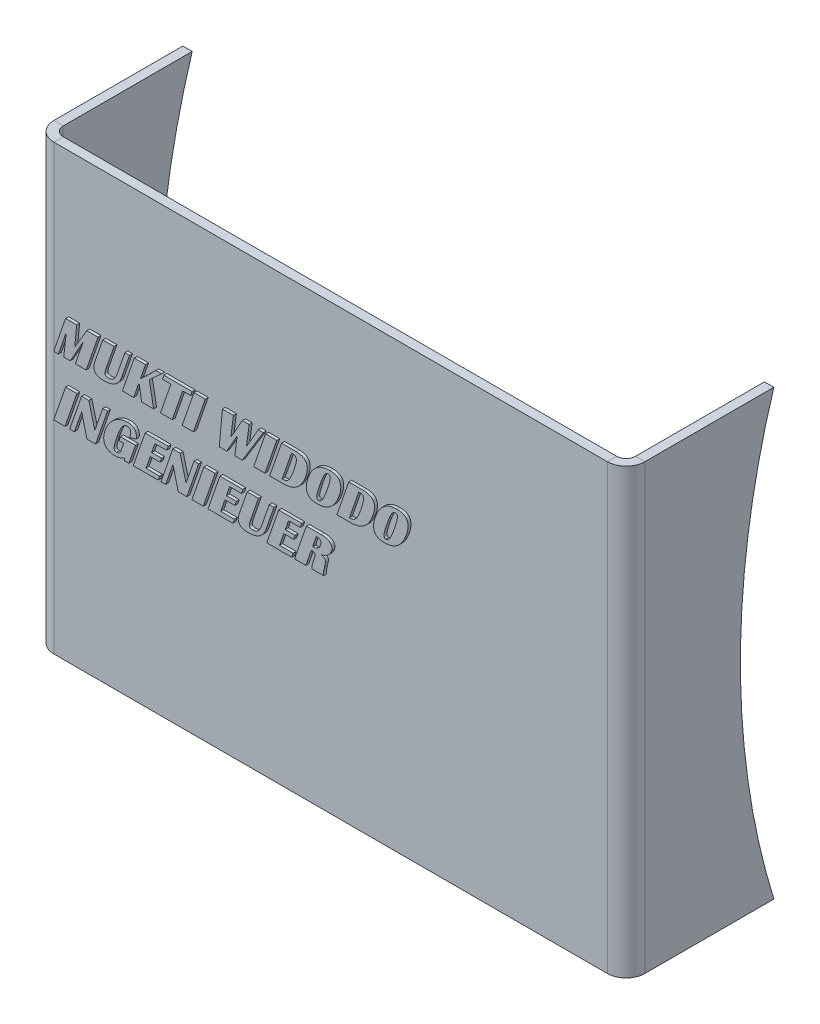
from build123d import *

# Parameters (mm, degrees)
BASE_FLANGE1_DEPTH             = 75
CUT_EXTRUDE1_REACH             = 136.629
CUT_EXTRUDE1_DIRECTION_2_REACH = 136.629
BOSS_EXTRUDE1_DEPTH            = 1


# Sheet-metal steps are written as plain solids
with BuildPart() as part:
    # Sketch1 → Base-Flange1 (new, symmetric)
    with BuildSketch(Plane(origin=(0, 0, 0), x_dir=(1, 0, 0), z_dir=(0, 1, 0))):
        with BuildLine():
            Line((-100, 50), (-100, 6.35))
            ThreePointArc((-100, 6.35), (-98.140128061, 1.859871939), (-93.65, 0))
            Line((-93.65, 0), (93.65, 0))
            ThreePointArc((93.65, 0), (98.140128061, 1.859871939), (100, 6.35))
            Line((100, 6.35), (100, 50))
            Line((100, 50), (96.825, 50))
            Line((96.825, 50), (96.825, 6.35))
            ThreePointArc((96.825, 6.35), (95.89506403, 4.10493597), (93.65, 3.175))
            Line((93.65, 3.175), (-93.65, 3.175))
            ThreePointArc((-93.65, 3.175), (-95.89506403, 4.10493597), (-96.825, 6.35))
            Line((-96.825, 6.35), (-96.825, 50))
            Line((-96.825, 50), (-100, 50))
        make_face()
    extrude(amount=BASE_FLANGE1_DEPTH, both=True)

    # Sketch6 → Cut-Extrude1 (cut, up to next)
    with BuildSketch(Plane(origin=(0, 0, 0), x_dir=(0, 0, -1), z_dir=(1, 0, 0)), mode=Mode.PRIVATE) as cut_extrude1_sk1:
        with BuildLine():
            Line((50, 75), (50, -75))
            ThreePointArc((50, -75), (38.674679355, 0), (50, 75))
        make_face()
    cut_extrude1_tool1 = extrude(cut_extrude1_sk1.sketch, amount=-CUT_EXTRUDE1_REACH, mode=Mode.PRIVATE) & part.part
    add(cut_extrude1_tool1.solids().sort_by_distance((0, 0, -45.461102))[0], mode=Mode.SUBTRACT)

    # Sketch6 → Cut-Extrude1 direction 2 (cut, up to next)
    with BuildSketch(Plane(origin=(0, 0, 0), x_dir=(0, 0, -1), z_dir=(1, 0, 0)), mode=Mode.PRIVATE) as cut_extrude1_direction_2_sk1:
        with BuildLine():
            Line((50, 75), (50, -75))
            ThreePointArc((50, -75), (38.674679355, 0), (50, 75))
        make_face()
    cut_extrude1_direction_2_tool1 = extrude(cut_extrude1_direction_2_sk1.sketch, amount=CUT_EXTRUDE1_DIRECTION_2_REACH, mode=Mode.PRIVATE) & part.part
    add(cut_extrude1_direction_2_tool1.solids().sort_by_distance((0, 0, -45.461102))[0], mode=Mode.SUBTRACT)

    # Sketch7 → Boss-Extrude1 (add)
    # profile 1 of 21: a face of its own
    with BuildSketch(Plane.XY):
        Polygon((-77.688894145, 26.320100911), (-81.712744141, 14.701171875), (-85.373502604, 14.701171875), (-82.672698466, 22.502665965), (-87.116839345, 14.701171875), (-89.312797038, 14.701171875), (-88.447345988, 22.370858765), (-91.103385417, 14.701171875), (-92.695019531, 14.701171875), (-88.671169535, 26.320100911), (-84.930829366, 26.320100911), (-85.589865367, 19.461152649), (-81.50881602, 26.320100911), align=None)
    # profile 2 of 21: a face of its own
    with BuildSketch(Plane.XY):
        with BuildLine():
            Line((-67.024945577, 26.320100911), (-69.71828893, 18.545963033))
            add(Edge.make_bspline(
                [(-69.71828893, 18.545963033), (-69.778067687, 18.38333502), (-69.895320407, 18.064349182), (-70.109063514, 17.61042146), (-70.344185944, 17.186278563), (-70.606943629, 16.794270156), (-70.892499446, 16.431245885), (-71.208099755, 16.102578106), (-71.545473536, 15.803144405), (-71.910904307, 15.537084212), (-72.300264523, 15.301607464), (-72.715310699, 15.096692569), (-73.155377358, 14.924342046), (-73.621730573, 14.786313586), (-74.112875917, 14.677028586), (-74.628692299, 14.597737239), (-75.169541154, 14.549613462), (-75.538429297, 14.544578354), (-75.726707713, 14.542008464)],
                knots=[0, 0, 0, 0, 1.06762481, 2.094086916, 3.089238705, 4.054405645, 5.000113119, 5.932612711, 6.859438436, 7.777275193, 8.714996723, 9.661118284, 10.627137087, 11.62464768, 12.656134527, 13.726483014, 14.839609821, 16, 16, 16, 16], degree=3))
            add(Edge.make_bspline(
                [(-75.726707713, 14.542008464), (-75.904211339, 14.544505222), (-76.245811575, 14.549310157), (-76.734907109, 14.595750898), (-77.17906163, 14.675200529), (-77.577930684, 14.782611043), (-77.932932887, 14.921353185), (-78.242468286, 15.092532326), (-78.505882903, 15.298741442), (-78.721613631, 15.537603292), (-78.895272076, 15.806293596), (-79.019678886, 16.108019152), (-79.095731109, 16.441529927), (-79.127629336, 16.804637186), (-79.108554251, 17.198096687), (-79.052258231, 17.622440031), (-78.94156347, 18.07629722), (-78.842361956, 18.384932177), (-78.790603383, 18.545963033)],
                knots=[0, 0, 0, 0, 1.333887678, 2.567025566, 3.687732696, 4.721648759, 5.666926028, 6.545649541, 7.37083136, 8.169257334, 8.953926247, 9.763913545, 10.608738382, 11.515809463, 12.494738975, 13.563603365, 14.728805576, 16, 16, 16, 16], degree=3))
            Line((-78.790603383, 18.545963033), (-76.09726003, 26.320100911))
            Line((-76.09726003, 26.320100911), (-72.277338155, 26.320100911))
            Line((-72.277338155, 26.320100911), (-75.003011576, 18.448972829))
            add(Edge.make_bspline(
                [(-75.003011576, 18.448972829), (-75.040956809, 18.336444664), (-75.113432771, 18.121514181), (-75.206451649, 17.812777845), (-75.273805581, 17.532638761), (-75.321479554, 17.283774164), (-75.352220378, 17.065442999), (-75.354375375, 16.876033749), (-75.340458502, 16.716250808), (-75.300482298, 16.582521866), (-75.234366265, 16.473444529), (-75.148545518, 16.379917163), (-75.038996123, 16.302086016), (-74.907059961, 16.240764829), (-74.753649687, 16.190520557), (-74.577295138, 16.157431465), (-74.378405921, 16.137906428), (-74.238745671, 16.135117105), (-74.164916738, 16.133642578)],
                knots=[0, 0, 0, 0, 1.780926124, 3.401595595, 4.83388636, 6.099343619, 7.201887816, 8.134382808, 8.934786184, 9.599296557, 10.20694826, 10.831656646, 11.490678481, 12.207982959, 13.00606576, 13.905745481, 14.892909209, 16, 16, 16, 16], degree=3))
            add(Edge.make_bspline(
                [(-74.164916738, 16.133642578), (-74.081947807, 16.13570753), (-73.918871591, 16.139766212), (-73.679136752, 16.167185182), (-73.449245293, 16.214080918), (-73.229192722, 16.282379333), (-73.017803605, 16.366801336), (-72.813913898, 16.468236183), (-72.622863664, 16.594864045), (-72.438468224, 16.736158405), (-72.262917464, 16.89604396), (-72.099879968, 17.076946919), (-71.940491227, 17.272705884), (-71.79947883, 17.493231053), (-71.660227214, 17.728435567), (-71.531824866, 17.983281592), (-71.415374775, 18.258245689), (-71.345585233, 18.448661357), (-71.309923045, 18.545963033)],
                knots=[0, 0, 0, 0, 0.989593349, 1.945055062, 2.873950793, 3.784132731, 4.689359795, 5.587048818, 6.494864408, 7.418482279, 8.356334332, 9.322126762, 10.321257869, 11.36340142, 12.440288738, 13.581188726, 14.763996722, 16, 16, 16, 16], degree=3))
            Line((-71.309923045, 18.545963033), (-68.616579692, 26.320100911))
            Line((-68.616579692, 26.320100911), (-67.024945577, 26.320100911))
        make_face()
    # profile 3 of 21: a face of its own
    with BuildSketch(Plane.XY):
        Polygon((-56.209294383, 26.320100911), (-60.335108439, 22.525048319), (-58.897663879, 14.701171875), (-62.946383158, 14.701171875), (-63.777017212, 19.610368347), (-64.067987823, 19.229868317), (-65.637239583, 14.701171875), (-69.457161458, 14.701171875), (-65.433311462, 26.320100911), (-61.613389587, 26.320100911), (-63.374134827, 21.236819458), (-58.136663818, 26.320100911), align=None)
    # profile 4 of 21: a face of its own
    with BuildSketch(Plane.XY):
        Polygon((-45.856211853, 26.320100911), (-46.353597514, 24.887630208), (-49.059375509, 24.887630208), (-52.585839844, 14.701171875), (-56.56492513, 14.701171875), (-53.038460795, 24.887630208), (-55.903402201, 24.887630208), (-55.406016541, 26.320100911), align=None)
    # profile 5 of 21: a face of its own
    with BuildSketch(Plane.XY):
        Polygon((-41.399636332, 26.320100911), (-45.423486328, 14.701171875), (-49.243408203, 14.701171875), (-45.219558207, 26.320100911), align=None)
    # profile 6 of 21: a face of its own
    with BuildSketch(Plane.XY):
        Polygon((-21.75290273, 26.320100911), (-28.887900035, 14.701171875), (-31.412132263, 14.701171875), (-30.658592987, 20.819015503), (-34.167648824, 14.701171875), (-36.689394124, 14.701171875), (-35.600119527, 26.320100911), (-31.884648641, 26.320100911), (-32.769995117, 19.428822581), (-28.88043925, 26.320100911), (-26.555161285, 26.320100911), (-27.462890116, 19.403953298), (-23.481317902, 26.320100911), align=None)
    # profile 7 of 21: a face of its own
    with BuildSketch(Plane.XY):
        Polygon((-17.206797791, 26.320100911), (-21.230647786, 14.701171875), (-25.050569661, 14.701171875), (-21.026719666, 26.320100911), align=None)
    # profile 8 of 21: a face of its own
    with BuildSketch(Plane.XY):
        with BuildLine():
            Line((-19.639013672, 14.701171875), (-15.615163676, 26.320100911))
            Line((-15.615163676, 26.320100911), (-10.713427989, 26.320100911))
            add(Edge.make_bspline(
                [(-10.713427989, 26.320100911), (-10.502628175, 26.31656504), (-10.09883462, 26.309791969), (-9.521524092, 26.237867742), (-8.999314173, 26.130403654), (-8.533396087, 25.97197682), (-8.126577292, 25.763534199), (-7.771335475, 25.515393173), (-7.478998297, 25.213183893), (-7.241014099, 24.867688087), (-7.063936944, 24.475041198), (-6.948291632, 24.03724844), (-6.88732174, 23.555790192), (-6.885052583, 23.029458748), (-6.939849669, 22.45857061), (-7.052273627, 21.8430378), (-7.218560057, 21.181420797), (-7.367947793, 20.731884658), (-7.445604197, 20.498201752)],
                knots=[0, 0, 0, 0, 1.199846364, 2.29834278, 3.307609779, 4.231750021, 5.091059981, 5.903264349, 6.687791024, 7.472147237, 8.281286335, 9.127595197, 10.041648228, 11.037790636, 12.118698521, 13.303103117, 14.598068887, 16, 16, 16, 16], degree=3))
            add(Edge.make_bspline(
                [(-7.445604197, 20.498201752), (-7.530737668, 20.263366227), (-7.697472437, 19.803438464), (-7.989041584, 19.144999907), (-8.311123524, 18.533758388), (-8.652267082, 17.962929571), (-9.027104473, 17.441657018), (-9.428166269, 16.965561162), (-9.854441056, 16.531577087), (-10.311063414, 16.146366642), (-10.792090771, 15.802766663), (-11.302456159, 15.508708943), (-11.83920438, 15.259091753), (-12.403511459, 15.054829199), (-12.994339752, 14.896157457), (-13.611979766, 14.781257343), (-14.256613444, 14.713740003), (-14.695669591, 14.705407131), (-14.918823751, 14.701171875)],
                knots=[0, 0, 0, 0, 1.175487723, 2.302204655, 3.386028049, 4.425913847, 5.429691486, 6.404389562, 7.353510685, 8.289255955, 9.212751179, 10.132297883, 11.057497802, 11.995566779, 12.95342986, 13.933758182, 14.949814373, 16, 16, 16, 16], degree=3))
            Line((-14.918823751, 14.701171875), (-19.639013672, 14.701171875))
        make_face()
        with BuildLine():
            Line((-15.378905487, 15.974479167), (-14.839242045, 15.974479167))
            add(Edge.make_bspline(
                [(-14.839242045, 15.974479167), (-14.754485474, 15.977264909), (-14.58707678, 15.982767225), (-14.341321885, 16.029090097), (-14.105072267, 16.104487425), (-13.877617959, 16.209375932), (-13.659719717, 16.345843822), (-13.450193089, 16.51062537), (-13.250677817, 16.70617219), (-13.058438877, 16.935745186), (-12.867197089, 17.205515996), (-12.678377634, 17.526419671), (-12.477886879, 17.895304865), (-12.275960661, 18.318694749), (-12.067074292, 18.793972553), (-11.85533074, 19.321737128), (-11.631450605, 19.898940939), (-11.490539284, 20.304574932), (-11.417228699, 20.51561025)],
                knots=[0, 0, 0, 0, 0.67208627, 1.327485094, 1.97651552, 2.635764922, 3.309298096, 4.011974962, 4.746914571, 5.521745449, 6.385030835, 7.367578791, 8.474199216, 9.715697475, 11.088171152, 12.593015679, 14.227480853, 16, 16, 16, 16], degree=3))
            add(Edge.make_bspline(
                [(-11.417228699, 20.51561025), (-11.345888737, 20.725050955), (-11.209284141, 21.126096347), (-11.027832078, 21.703845988), (-10.877230829, 22.230332857), (-10.757995571, 22.703948674), (-10.665710096, 23.124787851), (-10.607781923, 23.494361739), (-10.577167151, 23.811798965), (-10.580103117, 24.082316527), (-10.613758259, 24.312310892), (-10.677781137, 24.508896175), (-10.771432665, 24.677287767), (-10.898638374, 24.814210471), (-11.057099543, 24.920626228), (-11.245338629, 24.994777771), (-11.462398416, 25.039533671), (-11.616779382, 25.044285771), (-11.698251597, 25.04679362)],
                knots=[0, 0, 0, 0, 1.989078492, 3.8087666, 5.443607812, 6.911317475, 8.199066825, 9.315292309, 10.272742125, 11.062859134, 11.741660374, 12.354407952, 12.911811189, 13.460274503, 14.018374805, 14.613464473, 15.268276889, 16, 16, 16, 16], degree=3))
            Line((-11.698251597, 25.04679362), (-12.237915039, 25.04679362))
            Line((-12.237915039, 25.04679362), (-15.378905487, 15.974479167))
        make_face(mode=Mode.SUBTRACT)
    # profile 9 of 21: a face of its own
    with BuildSketch(Plane.XY):
        with BuildLine():
            add(Edge.make_bspline(
                [(0.686651357, 26.479264323), (0.793608979, 26.478507447), (1.002702194, 26.477027817), (1.308969392, 26.459709717), (1.600753762, 26.428724023), (1.879564387, 26.391732537), (2.142421788, 26.334145893), (2.393021801, 26.27520649), (2.62686008, 26.19564713), (2.848997418, 26.110549862), (3.05504907, 26.009854965), (3.249259018, 25.90181602), (3.424036658, 25.775039338), (3.591405952, 25.644693374), (3.73943034, 25.496920982), (3.875076613, 25.339023424), (3.997529004, 25.169874123), (4.103986944, 24.987916003), (4.196856759, 24.795170218), (4.274113923, 24.590413041), (4.335006383, 24.373688582), (4.386074127, 24.145654834), (4.419845251, 23.906127395), (4.439186701, 23.654460971), (4.447071293, 23.392159037), (4.438952191, 23.117391556), (4.416717254, 22.831852283), (4.377700783, 22.534336973), (4.329511851, 22.225354666), (4.26312314, 21.904635983), (4.184427872, 21.572630734), (4.088261254, 21.229138625), (3.982439174, 20.872787301), (3.901376417, 20.633074734), (3.859971873, 20.510636393)],
                knots=[0, 0, 0, 0, 1.204800425, 2.355284169, 3.453610514, 4.510131669, 5.521098759, 6.483680638, 7.407995139, 8.301071946, 9.16147408, 9.989649956, 10.800588015, 11.591050584, 12.376865937, 13.151729403, 13.934431282, 14.725610625, 15.523375924, 16.342020047, 17.18734014, 18.057417946, 18.972630349, 19.909455467, 20.899723916, 21.927331621, 23.004533177, 24.124598212, 25.306747246, 26.526474494, 27.813008637, 29.149674926, 30.544135269, 32, 32, 32, 32], degree=3))
            add(Edge.make_bspline(
                [(3.859971873, 20.510636393), (3.772448532, 20.268290633), (3.601561338, 19.795116437), (3.302636245, 19.118140005), (2.981794368, 18.486586718), (2.631769729, 17.902355472), (2.260586994, 17.363363954), (1.859116247, 16.874058061), (1.438334329, 16.425710034), (0.984610363, 16.030190807), (0.509833639, 15.675534911), (0.003634204, 15.376797559), (-0.521834303, 15.11348252), (-1.077307501, 14.907031863), (-1.656146612, 14.739655804), (-2.262157829, 14.629878174), (-2.891703921, 14.55249549), (-3.320370529, 14.545546675), (-3.538639832, 14.542008464)],
                knots=[0, 0, 0, 0, 1.206973039, 2.356585477, 3.464865038, 4.524002799, 5.545434603, 6.528174776, 7.487021594, 8.422784073, 9.344904496, 10.259492787, 11.173189891, 12.095130329, 13.032004577, 13.992611989, 14.977874244, 16, 16, 16, 16], degree=3))
            add(Edge.make_bspline(
                [(-3.538639832, 14.542008464), (-3.643957481, 14.542485715), (-3.850651126, 14.543422355), (-4.152579629, 14.564764732), (-4.440349213, 14.594760442), (-4.714111593, 14.632292508), (-4.973260502, 14.688998067), (-5.219665036, 14.752022344), (-5.451516487, 14.829297983), (-5.668638268, 14.91861349), (-5.871362877, 15.021200475), (-6.059804579, 15.13545696), (-6.235576646, 15.259621448), (-6.395176253, 15.398025023), (-6.542951666, 15.545907723), (-6.671682048, 15.709709438), (-6.789543753, 15.882097857), (-6.895160108, 16.065665775), (-6.980942107, 16.264326512), (-7.056698712, 16.473195148), (-7.114800279, 16.694980479), (-7.163172076, 16.927177995), (-7.194898329, 17.171580797), (-7.212035184, 17.428207359), (-7.214365313, 17.697245603), (-7.200781976, 17.977643653), (-7.176676093, 18.26986547), (-7.135215542, 18.573174897), (-7.084616916, 18.889819629), (-7.012900098, 19.217575897), (-6.931201633, 19.557623558), (-6.837269447, 19.909929573), (-6.724038516, 20.272293331), (-6.641930196, 20.517413343), (-6.600048574, 20.642443593)],
                knots=[0, 0, 0, 0, 1.177524824, 2.310979214, 3.382898207, 4.413406412, 5.398895287, 6.347818294, 7.256630599, 8.129505236, 8.971149968, 9.794730444, 10.59222617, 11.374543583, 12.154660691, 12.92635942, 13.700337914, 14.489164951, 15.290209182, 16.117122319, 16.971687736, 17.851671987, 18.768159293, 19.725243968, 20.726522434, 21.775136496, 22.863762967, 24.004473474, 25.197839744, 26.448800331, 27.755212622, 29.10902046, 30.525375831, 32, 32, 32, 32], degree=3))
            add(Edge.make_bspline(
                [(-6.600048574, 20.642443593), (-6.514027972, 20.878928725), (-6.345641396, 21.341851803), (-6.053026173, 22.004056306), (-5.738671918, 22.622215085), (-5.396803442, 23.193608831), (-5.032184979, 23.720970055), (-4.637481999, 24.199744307), (-4.219051294, 24.634613687), (-3.774808537, 25.023940053), (-3.306177497, 25.370108657), (-2.809135986, 25.665121997), (-2.289535419, 25.919488162), (-1.742442103, 26.122374245), (-1.170952253, 26.282183918), (-0.574475297, 26.395410325), (0.047384439, 26.467761978), (0.470912494, 26.475382528), (0.686651357, 26.479264323)],
                knots=[0, 0, 0, 0, 1.200161467, 2.349333494, 3.451180409, 4.506462502, 5.523407201, 6.506717697, 7.463197951, 8.399184543, 9.321436574, 10.238365733, 11.152758667, 12.077525369, 13.017821081, 13.980307485, 14.971198807, 16, 16, 16, 16], degree=3))
        make_face()
        with BuildLine():
            add(Edge.make_bspline(
                [(0.1544487, 25.205957031), (0.102784955, 25.202806835), (-0.002200334, 25.196405359), (-0.158855837, 25.151734008), (-0.31464294, 25.078177102), (-0.468649241, 24.973963547), (-0.62405552, 24.844285229), (-0.775407329, 24.681765278), (-0.928988384, 24.493708397), (-1.084394384, 24.271459844), (-1.242790249, 24.004185585), (-1.411574769, 23.68189741), (-1.590774201, 23.299194074), (-1.786163169, 22.858123421), (-1.987386664, 22.355809834), (-2.204863627, 21.794962615), (-2.432795853, 21.173648287), (-2.585860797, 20.737968278), (-2.665727997, 20.510636393)],
                knots=[0, 0, 0, 0, 0.434936526, 0.88382941, 1.361759986, 1.880770504, 2.445791197, 3.063139238, 3.74799254, 4.489912387, 5.344917617, 6.363140169, 7.553136736, 8.903719756, 10.425965568, 12.110380656, 13.970449686, 16, 16, 16, 16], degree=3))
            add(Edge.make_bspline(
                [(-2.665727997, 20.510636393), (-2.743581596, 20.283748624), (-2.892143031, 19.850797893), (-3.09252116, 19.228402425), (-3.268996871, 18.667479942), (-3.409957508, 18.165333163), (-3.524514203, 17.723888317), (-3.605589737, 17.341928041), (-3.664668832, 17.020682465), (-3.688620506, 16.753370057), (-3.687058867, 16.530855109), (-3.665535345, 16.342204281), (-3.626072574, 16.180161669), (-3.559733287, 16.048282755), (-3.477301665, 15.940551552), (-3.368312721, 15.866493398), (-3.239174763, 15.823254852), (-3.146882884, 15.818048004), (-3.098453522, 15.815315755)],
                knots=[0, 0, 0, 0, 2.22933397, 4.254049373, 6.076889104, 7.693983232, 9.10107207, 10.314508896, 11.322746395, 12.13469098, 12.805031536, 13.387018744, 13.897209229, 14.345134851, 14.750631659, 15.143865984, 15.550751109, 16, 16, 16, 16], degree=3))
            add(Edge.make_bspline(
                [(-3.098453522, 15.815315755), (-3.035179171, 15.81818376), (-2.907889063, 15.823953375), (-2.721152379, 15.871150188), (-2.537861985, 15.944015731), (-2.362234498, 16.049806355), (-2.191038121, 16.184221596), (-2.025196722, 16.346656441), (-1.86202597, 16.537400087), (-1.702939534, 16.764214397), (-1.542631558, 17.036481294), (-1.371916548, 17.360601962), (-1.187754671, 17.74177645), (-0.994590887, 18.182601275), (-0.792271111, 18.682768307), (-0.575541858, 19.239463051), (-0.349576615, 19.855089925), (-0.198158866, 20.285793698), (-0.119113413, 20.510636393)],
                knots=[0, 0, 0, 0, 0.520065514, 1.046224799, 1.575734327, 2.138476312, 2.726611712, 3.363413144, 4.045621394, 4.789472788, 5.640004708, 6.644006539, 7.803401583, 9.122892851, 10.603776492, 12.243053873, 14.038740442, 16, 16, 16, 16], degree=3))
            add(Edge.make_bspline(
                [(-0.119113413, 20.510636393), (-0.042135303, 20.734220307), (0.104909245, 21.161313094), (0.30398077, 21.775647057), (0.473631295, 22.331853177), (0.613242244, 22.830326835), (0.7264619, 23.269358541), (0.809873602, 23.650716225), (0.864711689, 23.974343076), (0.888218844, 24.245423477), (0.8895141, 24.47358098), (0.858537907, 24.667383788), (0.810207624, 24.835191925), (0.727292313, 24.971461841), (0.621533831, 25.080400131), (0.48576997, 25.152801659), (0.328212792, 25.198998525), (0.214500501, 25.203552214), (0.1544487, 25.205957031)],
                knots=[0, 0, 0, 0, 2.154075865, 4.114742649, 5.882550785, 7.450979498, 8.830152705, 10.012132803, 11.006580436, 11.817465877, 12.489609787, 13.078109817, 13.601143561, 14.068678702, 14.517226922, 14.966854529, 15.45439279, 16, 16, 16, 16], degree=3))
        make_face(mode=Mode.SUBTRACT)
    # profile 10 of 21: a face of its own
    with BuildSketch(Plane.XY):
        with BuildLine():
            Line((3.121354167, 14.701171875), (7.145204163, 26.320100911))
            Line((7.145204163, 26.320100911), (12.04693985, 26.320100911))
            add(Edge.make_bspline(
                [(12.04693985, 26.320100911), (12.257739663, 26.31656504), (12.661533219, 26.309791969), (13.238843747, 26.237867742), (13.761053666, 26.130403654), (14.226971752, 25.97197682), (14.633790546, 25.763534199), (14.989032363, 25.515393173), (15.281369542, 25.213183893), (15.51935374, 24.867688087), (15.696430895, 24.475041198), (15.812076207, 24.03724844), (15.873046099, 23.555790192), (15.875315256, 23.029458748), (15.82051817, 22.45857061), (15.708094212, 21.8430378), (15.541807782, 21.181420797), (15.392420046, 20.731884658), (15.314763641, 20.498201752)],
                knots=[0, 0, 0, 0, 1.199846364, 2.29834278, 3.307609779, 4.231750021, 5.091059981, 5.903264349, 6.687791024, 7.472147237, 8.281286335, 9.127595197, 10.041648228, 11.037790636, 12.118698521, 13.303103117, 14.598068887, 16, 16, 16, 16], degree=3))
            add(Edge.make_bspline(
                [(15.314763641, 20.498201752), (15.22963017, 20.263366227), (15.062895402, 19.803438464), (14.771326255, 19.144999907), (14.449244315, 18.533758388), (14.108100757, 17.962929571), (13.733263366, 17.441657018), (13.33220157, 16.965561162), (12.905926783, 16.531577087), (12.449304424, 16.146366642), (11.968277068, 15.802766663), (11.45791168, 15.508708943), (10.921163459, 15.259091753), (10.35685638, 15.054829199), (9.766028087, 14.896157457), (9.148388072, 14.781257343), (8.503754395, 14.713740003), (8.064698247, 14.705407131), (7.841544088, 14.701171875)],
                knots=[0, 0, 0, 0, 1.175487723, 2.302204655, 3.386028049, 4.425913847, 5.429691486, 6.404389562, 7.353510685, 8.289255955, 9.212751179, 10.132297883, 11.057497802, 11.995566779, 12.95342986, 13.933758182, 14.949814373, 16, 16, 16, 16], degree=3))
            Line((7.841544088, 14.701171875), (3.121354167, 14.701171875))
        make_face()
        with BuildLine():
            Line((7.381462351, 15.974479167), (7.921125793, 15.974479167))
            add(Edge.make_bspline(
                [(7.921125793, 15.974479167), (8.005882365, 15.977264909), (8.173291059, 15.982767225), (8.419045953, 16.029090097), (8.655295572, 16.104487425), (8.882749879, 16.209375932), (9.100648122, 16.345843822), (9.310174749, 16.51062537), (9.509690022, 16.70617219), (9.701928962, 16.935745186), (9.89317075, 17.205515996), (10.081990204, 17.526419671), (10.282480959, 17.895304865), (10.484407177, 18.318694749), (10.693293547, 18.793972553), (10.905037098, 19.321737128), (11.128917233, 19.898940939), (11.269828555, 20.304574932), (11.34313914, 20.51561025)],
                knots=[0, 0, 0, 0, 0.67208627, 1.327485094, 1.97651552, 2.635764922, 3.309298096, 4.011974962, 4.746914571, 5.521745449, 6.385030835, 7.367578791, 8.474199216, 9.715697475, 11.088171152, 12.593015679, 14.227480853, 16, 16, 16, 16], degree=3))
            add(Edge.make_bspline(
                [(11.34313914, 20.51561025), (11.414479102, 20.725050955), (11.551083698, 21.126096347), (11.73253576, 21.703845988), (11.883137009, 22.230332857), (12.002372267, 22.703948674), (12.094657743, 23.124787851), (12.152585915, 23.494361739), (12.183200687, 23.811798965), (12.180264722, 24.082316527), (12.14660958, 24.312310892), (12.082586702, 24.508896175), (11.988935174, 24.677287767), (11.861729465, 24.814210471), (11.703268295, 24.920626228), (11.51502921, 24.994777771), (11.297969423, 25.039533671), (11.143588457, 25.044285771), (11.062116241, 25.04679362)],
                knots=[0, 0, 0, 0, 1.989078492, 3.8087666, 5.443607812, 6.911317475, 8.199066825, 9.315292309, 10.272742125, 11.062859134, 11.741660374, 12.354407952, 12.911811189, 13.460274503, 14.018374805, 14.613464473, 15.268276889, 16, 16, 16, 16], degree=3))
            Line((11.062116241, 25.04679362), (10.522452799, 25.04679362))
            Line((10.522452799, 25.04679362), (7.381462351, 15.974479167))
        make_face(mode=Mode.SUBTRACT)
    # profile 11 of 21: a face of its own
    with BuildSketch(Plane.XY):
        with BuildLine():
            add(Edge.make_bspline(
                [(23.447019196, 26.479264323), (23.553976818, 26.478507447), (23.763070033, 26.477027817), (24.069337231, 26.459709717), (24.361121601, 26.428724023), (24.639932226, 26.391732537), (24.902789627, 26.334145893), (25.15338964, 26.27520649), (25.387227918, 26.19564713), (25.609365257, 26.110549862), (25.815416908, 26.009854965), (26.009626856, 25.90181602), (26.184404497, 25.775039338), (26.35177379, 25.644693374), (26.499798178, 25.496920982), (26.635444451, 25.339023424), (26.757896843, 25.169874123), (26.864354783, 24.987916003), (26.957224597, 24.795170218), (27.034481762, 24.590413041), (27.095374222, 24.373688582), (27.146441965, 24.145654834), (27.180213089, 23.906127395), (27.199554539, 23.654460971), (27.207439131, 23.392159037), (27.199320029, 23.117391556), (27.177085092, 22.831852283), (27.138068622, 22.534336973), (27.08987969, 22.225354666), (27.023490979, 21.904635983), (26.94479571, 21.572630734), (26.848629093, 21.229138625), (26.742807013, 20.872787301), (26.661744255, 20.633074734), (26.620339712, 20.510636393)],
                knots=[0, 0, 0, 0, 1.204800425, 2.355284169, 3.453610514, 4.510131669, 5.521098759, 6.483680638, 7.407995139, 8.301071946, 9.16147408, 9.989649956, 10.800588015, 11.591050584, 12.376865937, 13.151729403, 13.934431282, 14.725610625, 15.523375924, 16.342020047, 17.18734014, 18.057417946, 18.972630349, 19.909455467, 20.899723916, 21.927331621, 23.004533177, 24.124598212, 25.306747246, 26.526474494, 27.813008637, 29.149674926, 30.544135269, 32, 32, 32, 32], degree=3))
            add(Edge.make_bspline(
                [(26.620339712, 20.510636393), (26.53281637, 20.268290633), (26.361929177, 19.795116437), (26.063004083, 19.118140005), (25.742162207, 18.486586718), (25.392137567, 17.902355472), (25.020954833, 17.363363954), (24.619484085, 16.874058061), (24.198702168, 16.425710034), (23.744978201, 16.030190807), (23.270201477, 15.675534911), (22.764002042, 15.376797559), (22.238533536, 15.11348252), (21.683060338, 14.907031863), (21.104221226, 14.739655804), (20.49821001, 14.629878174), (19.868663917, 14.55249549), (19.439997309, 14.545546675), (19.221728007, 14.542008464)],
                knots=[0, 0, 0, 0, 1.206973039, 2.356585477, 3.464865038, 4.524002799, 5.545434603, 6.528174776, 7.487021594, 8.422784073, 9.344904496, 10.259492787, 11.173189891, 12.095130329, 13.032004577, 13.992611989, 14.977874244, 16, 16, 16, 16], degree=3))
            add(Edge.make_bspline(
                [(19.221728007, 14.542008464), (19.116410358, 14.542485715), (18.909716713, 14.543422355), (18.60778821, 14.564764732), (18.320018625, 14.594760442), (18.046256245, 14.632292508), (17.787107336, 14.688998067), (17.540702803, 14.752022344), (17.308851352, 14.829297983), (17.091729571, 14.91861349), (16.889004962, 15.021200475), (16.700563259, 15.13545696), (16.524791192, 15.259621448), (16.365191585, 15.398025023), (16.217416172, 15.545907723), (16.08868579, 15.709709438), (15.970824085, 15.882097857), (15.865207731, 16.065665775), (15.779425732, 16.264326512), (15.703669126, 16.473195148), (15.645567559, 16.694980479), (15.597195762, 16.927177995), (15.565469509, 17.171580797), (15.548332654, 17.428207359), (15.546002525, 17.697245603), (15.559585863, 17.977643653), (15.583691746, 18.26986547), (15.625152297, 18.573174897), (15.675750922, 18.889819629), (15.74746774, 19.217575897), (15.829166206, 19.557623558), (15.923098392, 19.909929573), (16.036329322, 20.272293331), (16.118437642, 20.517413343), (16.160319265, 20.642443593)],
                knots=[0, 0, 0, 0, 1.177524824, 2.310979214, 3.382898207, 4.413406412, 5.398895287, 6.347818294, 7.256630599, 8.129505236, 8.971149968, 9.794730444, 10.59222617, 11.374543583, 12.154660691, 12.92635942, 13.700337914, 14.489164951, 15.290209182, 16.117122319, 16.971687736, 17.851671987, 18.768159293, 19.725243968, 20.726522434, 21.775136496, 22.863762967, 24.004473474, 25.197839744, 26.448800331, 27.755212622, 29.10902046, 30.525375831, 32, 32, 32, 32], degree=3))
            add(Edge.make_bspline(
                [(16.160319265, 20.642443593), (16.246339866, 20.878928725), (16.414726442, 21.341851803), (16.707341666, 22.004056306), (17.02169592, 22.622215085), (17.363564396, 23.193608831), (17.72818286, 23.720970055), (18.122885839, 24.199744307), (18.541316544, 24.634613687), (18.985559301, 25.023940053), (19.454190342, 25.370108657), (19.951231853, 25.665121997), (20.470832419, 25.919488162), (21.017925735, 26.122374245), (21.589415585, 26.282183918), (22.185892541, 26.395410325), (22.807752278, 26.467761978), (23.231280332, 26.475382528), (23.447019196, 26.479264323)],
                knots=[0, 0, 0, 0, 1.200161467, 2.349333494, 3.451180409, 4.506462502, 5.523407201, 6.506717697, 7.463197951, 8.399184543, 9.321436574, 10.238365733, 11.152758667, 12.077525369, 13.017821081, 13.980307485, 14.971198807, 16, 16, 16, 16], degree=3))
        make_face()
        with BuildLine():
            add(Edge.make_bspline(
                [(22.914816538, 25.205957031), (22.863152794, 25.202806835), (22.758167504, 25.196405359), (22.601512002, 25.151734008), (22.445724898, 25.078177102), (22.291718598, 24.973963547), (22.136312319, 24.844285229), (21.98496051, 24.681765278), (21.831379455, 24.493708397), (21.675973454, 24.271459844), (21.51757759, 24.004185585), (21.348793069, 23.68189741), (21.169593637, 23.299194074), (20.974204669, 22.858123421), (20.772981175, 22.355809834), (20.555504211, 21.794962615), (20.327571986, 21.173648287), (20.174507042, 20.737968278), (20.094639842, 20.510636393)],
                knots=[0, 0, 0, 0, 0.434936526, 0.88382941, 1.361759986, 1.880770504, 2.445791197, 3.063139238, 3.74799254, 4.489912387, 5.344917617, 6.363140169, 7.553136736, 8.903719756, 10.425965568, 12.110380656, 13.970449686, 16, 16, 16, 16], degree=3))
            add(Edge.make_bspline(
                [(20.094639842, 20.510636393), (20.016786243, 20.283748624), (19.868224807, 19.850797893), (19.667846679, 19.228402425), (19.491370967, 18.667479942), (19.350410331, 18.165333163), (19.235853635, 17.723888317), (19.154778102, 17.341928041), (19.095699006, 17.020682465), (19.071747333, 16.753370057), (19.073308972, 16.530855109), (19.094832493, 16.342204281), (19.134295265, 16.180161669), (19.200634551, 16.048282755), (19.283066174, 15.940551552), (19.392055117, 15.866493398), (19.521193076, 15.823254852), (19.613484955, 15.818048004), (19.661914317, 15.815315755)],
                knots=[0, 0, 0, 0, 2.22933397, 4.254049373, 6.076889104, 7.693983232, 9.10107207, 10.314508896, 11.322746395, 12.13469098, 12.805031536, 13.387018744, 13.897209229, 14.345134851, 14.750631659, 15.143865984, 15.550751109, 16, 16, 16, 16], degree=3))
            add(Edge.make_bspline(
                [(19.661914317, 15.815315755), (19.725188668, 15.81818376), (19.852478776, 15.823953375), (20.03921546, 15.871150188), (20.222505854, 15.944015731), (20.398133341, 16.049806355), (20.569329718, 16.184221596), (20.735171117, 16.346656441), (20.898341868, 16.537400087), (21.057428304, 16.764214397), (21.217736281, 17.036481294), (21.38845129, 17.360601962), (21.572613168, 17.74177645), (21.765776951, 18.182601275), (21.968096728, 18.682768307), (22.184825981, 19.239463051), (22.410791223, 19.855089925), (22.562208972, 20.285793698), (22.641254425, 20.510636393)],
                knots=[0, 0, 0, 0, 0.520065514, 1.046224799, 1.575734327, 2.138476312, 2.726611712, 3.363413144, 4.045621394, 4.789472788, 5.640004708, 6.644006539, 7.803401583, 9.122892851, 10.603776492, 12.243053873, 14.038740442, 16, 16, 16, 16], degree=3))
            add(Edge.make_bspline(
                [(22.641254425, 20.510636393), (22.718232535, 20.734220307), (22.865277084, 21.161313094), (23.064348608, 21.775647057), (23.233999134, 22.331853177), (23.373610083, 22.830326835), (23.486829739, 23.269358541), (23.57024144, 23.650716225), (23.625079527, 23.974343076), (23.648586683, 24.245423477), (23.649881939, 24.47358098), (23.618905745, 24.667383788), (23.570575463, 24.835191925), (23.487660151, 24.971461841), (23.381901669, 25.080400131), (23.246137809, 25.152801659), (23.08858063, 25.198998525), (22.974868339, 25.203552214), (22.914816538, 25.205957031)],
                knots=[0, 0, 0, 0, 2.154075865, 4.114742649, 5.882550785, 7.450979498, 8.830152705, 10.012132803, 11.006580436, 11.817465877, 12.489609787, 13.078109817, 13.601143561, 14.068678702, 14.517226922, 14.966854529, 15.45439279, 16, 16, 16, 16], degree=3))
        make_face(mode=Mode.SUBTRACT)
    # profile 12 of 21: a face of its own
    with BuildSketch(Plane.XY):
        Polygon((-84.85124766, 6.220491536), (-88.875097656, -5.3984375), (-92.695019531, -5.3984375), (-88.671169535, 6.220491536), align=None)
    # profile 13 of 21: a face of its own
    with BuildSketch(Plane.XY):
        Polygon((-74.505625916, 6.220491536), (-78.529475911, -5.3984375), (-81.441668955, -5.3984375), (-83.234744263, 1.696768951), (-85.691829427, -5.3984375), (-87.283463542, -5.3984375), (-83.259613546, 6.220491536), (-80.80501531, 6.220491536), (-78.783142598, -1.533750916), (-76.09726003, 6.220491536), align=None)
    # profile 14 of 21: a face of its own
    with BuildSketch(Plane.XY):
        with BuildLine():
            Line((-70.118684387, 0.968098958), (-65.025455221, 0.968098958))
            Line((-65.025455221, 0.968098958), (-67.228873698, -5.3984375))
            Line((-67.228873698, -5.3984375), (-68.696161397, -5.3984375))
            Line((-68.696161397, -5.3984375), (-68.726004537, -4.625002797))
            add(Edge.make_bspline(
                [(-68.726004537, -4.625002797), (-68.85104413, -4.6996984), (-69.097706213, -4.847048312), (-69.481440468, -5.035950959), (-69.868332687, -5.199256086), (-70.263295102, -5.32779025), (-70.661233583, -5.429699502), (-71.063743341, -5.506339427), (-71.472332503, -5.548168831), (-71.746706713, -5.554449107), (-71.884403483, -5.557600911)],
                knots=[0, 0, 0, 0, 1.047215502, 2.065812531, 3.073461491, 4.06523257, 5.050043136, 6.026515686, 7.009591983, 8, 8, 8, 8], degree=3))
            add(Edge.make_bspline(
                [(-71.884403483, -5.557600911), (-72.090230219, -5.55308504), (-72.485831789, -5.544405477), (-73.052990009, -5.471509448), (-73.568897051, -5.355606486), (-74.031730335, -5.185002516), (-74.444770565, -4.969081835), (-74.804893838, -4.701045215), (-75.109603998, -4.382051052), (-75.363795982, -4.019175465), (-75.556901707, -3.609840147), (-75.695274224, -3.16206465), (-75.770022037, -2.674708988), (-75.788058575, -2.150048972), (-75.749199975, -1.58686878), (-75.648831299, -0.986865662), (-75.49422629, -0.347632871), (-75.352639027, 0.084498167), (-75.279060618, 0.309062958)],
                knots=[0, 0, 0, 0, 1.170761448, 2.250218193, 3.247945703, 4.173243416, 5.048938877, 5.891391882, 6.715406424, 7.54893815, 8.40130294, 9.280092741, 10.206796089, 11.198080229, 12.261756414, 13.413337104, 14.655793353, 16, 16, 16, 16], degree=3))
            add(Edge.make_bspline(
                [(-75.279060618, 0.309062958), (-75.198451564, 0.529998365), (-75.038989529, 0.967056091), (-74.747371427, 1.595181113), (-74.422105462, 2.192739682), (-74.060678727, 2.758712506), (-73.664470507, 3.293096631), (-73.230632456, 3.794537662), (-72.758433056, 4.262246642), (-72.257073567, 4.698510957), (-71.730576624, 5.091210171), (-71.190657654, 5.436955941), (-70.637428863, 5.726317831), (-70.075379567, 5.967206419), (-69.50053468, 6.151307602), (-68.91586568, 6.284567017), (-68.319438236, 6.362679857), (-67.91797473, 6.373979109), (-67.716311646, 6.379654948)],
                knots=[0, 0, 0, 0, 1.091958505, 2.160128637, 3.212927607, 4.250070464, 5.276602352, 6.300241659, 7.326686888, 8.361188999, 9.384632761, 10.374819288, 11.335859294, 12.281307508, 13.211611891, 14.135431455, 15.063390227, 16, 16, 16, 16], degree=3))
            add(Edge.make_bspline(
                [(-67.716311646, 6.379654948), (-67.579394966, 6.377930502), (-67.3147965, 6.374597922), (-66.934138566, 6.330536225), (-66.582482878, 6.265077457), (-66.261813716, 6.17072587), (-65.968874546, 6.052478786), (-65.70930861, 5.901507423), (-65.476295178, 5.726853784), (-65.276837155, 5.521464179), (-65.107970395, 5.289398492), (-64.970479097, 5.03053783), (-64.864360594, 4.74519161), (-64.785990621, 4.43343228), (-64.744590881, 4.094513465), (-64.72617736, 3.729532887), (-64.742385023, 3.337775974), (-64.774857717, 3.069366187), (-64.79168396, 2.93028539)],
                knots=[0, 0, 0, 0, 1.221930164, 2.361442366, 3.416852209, 4.412308944, 5.341577493, 6.230339579, 7.086058955, 7.934059718, 8.776517828, 9.640838255, 10.542727553, 11.488854228, 12.504337893, 13.586306303, 14.749306259, 16, 16, 16, 16], degree=3))
            Line((-64.79168396, 2.93028539), (-67.089605713, 2.131981405))
            Line((-67.089605713, 2.131981405), (-66.855834452, 2.572167714))
            Line((-66.855834452, 2.572167714), (-66.763818105, 3.131726583))
            add(Edge.make_bspline(
                [(-66.763818105, 3.131726583), (-66.743925082, 3.211122111), (-66.705574896, 3.364182473), (-66.663471195, 3.588378667), (-66.634913458, 3.79662206), (-66.62400375, 3.990498753), (-66.631599265, 4.168614779), (-66.652707883, 4.332390248), (-66.692373486, 4.48065773), (-66.74934087, 4.613136497), (-66.822639232, 4.729529124), (-66.910776132, 4.831192889), (-67.017053368, 4.91662212), (-67.140057456, 4.98595127), (-67.278900437, 5.04105143), (-67.433398886, 5.080551048), (-67.604598861, 5.102432817), (-67.72370934, 5.105004125), (-67.785945638, 5.106347656)],
                knots=[0, 0, 0, 0, 1.444228967, 2.784214862, 4.023629448, 5.151660511, 6.20593644, 7.165960555, 8.06030884, 8.905564906, 9.701120972, 10.478717577, 11.269280706, 12.09493805, 12.961574226, 13.898353035, 14.901870519, 16, 16, 16, 16], degree=3))
            add(Edge.make_bspline(
                [(-67.785945638, 5.106347656), (-67.868240226, 5.103679647), (-68.032548667, 5.09835273), (-68.27415673, 5.049161713), (-68.508349807, 4.970636396), (-68.736050781, 4.86435896), (-68.953308755, 4.721432202), (-69.165321224, 4.552947255), (-69.367722547, 4.350488316), (-69.56758557, 4.115128428), (-69.766990317, 3.833472513), (-69.966833404, 3.494031932), (-70.177998283, 3.097136584), (-70.392217112, 2.637308685), (-70.618703808, 2.120274798), (-70.852099943, 1.543221613), (-71.090176457, 0.90468854), (-71.247655503, 0.457712335), (-71.329818471, 0.224507395)],
                knots=[0, 0, 0, 0, 0.616919972, 1.231735428, 1.841495788, 2.467535982, 3.111098631, 3.788176072, 4.496312197, 5.255317558, 6.102759352, 7.082025445, 8.208963026, 9.474948589, 10.887130898, 12.444145515, 14.144771862, 16, 16, 16, 16], degree=3))
            add(Edge.make_bspline(
                [(-71.329818471, 0.224507395), (-71.404530136, 0.006796002), (-71.546726351, -0.407566817), (-71.735395035, -1.004355423), (-71.897959927, -1.541688093), (-72.029703125, -2.023020088), (-72.125226678, -2.447604123), (-72.198596787, -2.813467521), (-72.237397098, -3.122701618), (-72.247875197, -3.380215942), (-72.228670966, -3.596137972), (-72.184776755, -3.779149888), (-72.118181261, -3.936098537), (-72.023245167, -4.063181495), (-71.907139358, -4.166570147), (-71.763540795, -4.236460223), (-71.597172042, -4.27578393), (-71.479258936, -4.281348779), (-71.416860962, -4.28429362)],
                knots=[0, 0, 0, 0, 2.156449413, 4.104298102, 5.863672172, 7.41611262, 8.778333509, 9.940575044, 10.910674967, 11.695464357, 12.350824837, 12.934780326, 13.452888277, 13.935991146, 14.409445489, 14.895721992, 15.415631457, 16, 16, 16, 16], degree=3))
            add(Edge.make_bspline(
                [(-71.416860962, -4.28429362), (-71.330309016, -4.280584935), (-71.162650691, -4.273400905), (-70.921815512, -4.214475132), (-70.701854804, -4.118090484), (-70.49962265, -3.986378535), (-70.324411261, -3.808737259), (-70.167189676, -3.597987697), (-70.028391202, -3.349265232), (-69.960281981, -3.164631978), (-69.924703979, -3.068185679)],
                knots=[0, 0, 0, 0, 1.001325537, 1.939650915, 2.851022597, 3.772250494, 4.715815629, 5.723791517, 6.810984053, 8, 8, 8, 8], degree=3))
            Line((-69.924703979, -3.068185679), (-69.021949005, -0.464371745))
            Line((-69.021949005, -0.464371745), (-70.61358312, -0.464371745))
            Line((-70.61358312, -0.464371745), (-70.118684387, 0.968098958))
        make_face()
    # profile 15 of 21: a face of its own
    with BuildSketch(Plane.XY):
        Polygon((-53.973545837, 6.220491536), (-54.470931498, 4.788020833), (-58.450016785, 4.788020833), (-59.551726023, 1.604752604), (-56.209294383, 1.604752604), (-56.704193115, 0.172281901), (-60.046624756, 0.172281901), (-61.481582387, -3.965966797), (-56.865843455, -3.965966797), (-57.360742188, -5.3984375), (-65.796402995, -5.3984375), (-61.772552999, 6.220491536), align=None)
    # profile 16 of 21: a face of its own
    with BuildSketch(Plane.XY):
        Polygon((-43.627924093, 6.220491536), (-47.651774089, -5.3984375), (-50.563967133, -5.3984375), (-52.35704244, 1.696768951), (-54.814127604, -5.3984375), (-56.405761719, -5.3984375), (-52.381911723, 6.220491536), (-49.927313487, 6.220491536), (-47.905440776, -1.533750916), (-45.219558207, 6.220491536), align=None)
    # profile 17 of 21: a face of its own
    with BuildSketch(Plane.XY):
        Polygon((-38.057204692, 6.220491536), (-42.081054688, -5.3984375), (-45.900976563, -5.3984375), (-41.877126567, 6.220491536), align=None)
    # profile 18 of 21: a face of its own
    with BuildSketch(Plane.XY):
        Polygon((-28.666563416, 6.220491536), (-29.163949076, 4.788020833), (-33.143034363, 4.788020833), (-34.244743601, 1.604752604), (-30.902311961, 1.604752604), (-31.397210693, 0.172281901), (-34.739642334, 0.172281901), (-36.174599965, -3.965966797), (-31.558861033, -3.965966797), (-32.053759766, -5.3984375), (-40.489420573, -5.3984375), (-36.465570577, 6.220491536), align=None)
    # profile 19 of 21: a face of its own
    with BuildSketch(Plane.XY):
        with BuildLine():
            Line((-18.161778259, 6.220491536), (-20.855121613, -1.553646342))
            add(Edge.make_bspline(
                [(-20.855121613, -1.553646342), (-20.914900369, -1.716274355), (-21.032153089, -2.035260193), (-21.245896196, -2.489187915), (-21.481018626, -2.913330812), (-21.743776311, -3.305339219), (-22.029332128, -3.66836349), (-22.344932437, -3.997031269), (-22.682306218, -4.29646497), (-23.047736989, -4.562525163), (-23.437097205, -4.798001911), (-23.852143381, -5.002916806), (-24.29221004, -5.175267329), (-24.758563255, -5.313295789), (-25.2497086, -5.422580789), (-25.765524981, -5.501872136), (-26.306373836, -5.549995913), (-26.675261979, -5.555031021), (-26.863540395, -5.557600911)],
                knots=[0, 0, 0, 0, 1.06762481, 2.094086916, 3.089238705, 4.054405645, 5.000113119, 5.932612711, 6.859438436, 7.777275193, 8.714996723, 9.661118284, 10.627137087, 11.62464768, 12.656134527, 13.726483014, 14.839609821, 16, 16, 16, 16], degree=3))
            add(Edge.make_bspline(
                [(-26.863540395, -5.557600911), (-27.041044021, -5.555104153), (-27.382644257, -5.550299218), (-27.871739791, -5.503858477), (-28.315894312, -5.424408846), (-28.714763366, -5.316998332), (-29.069765569, -5.17825619), (-29.379300969, -5.007077049), (-29.642715585, -4.800867933), (-29.858446313, -4.562006083), (-30.032104759, -4.293315779), (-30.156511569, -3.991590223), (-30.232563791, -3.658079448), (-30.264462018, -3.294972189), (-30.245386934, -2.901512688), (-30.189090914, -2.477169344), (-30.078396152, -2.023312155), (-29.979194638, -1.714677198), (-29.927436066, -1.553646342)],
                knots=[0, 0, 0, 0, 1.333887678, 2.567025566, 3.687732696, 4.721648759, 5.666926028, 6.545649541, 7.37083136, 8.169257334, 8.953926247, 9.763913545, 10.608738382, 11.515809463, 12.494738975, 13.563603365, 14.728805576, 16, 16, 16, 16], degree=3))
            Line((-29.927436066, -1.553646342), (-27.234092712, 6.220491536))
            Line((-27.234092712, 6.220491536), (-23.414170837, 6.220491536))
            Line((-23.414170837, 6.220491536), (-26.139844259, -1.650636546))
            add(Edge.make_bspline(
                [(-26.139844259, -1.650636546), (-26.177789491, -1.763164711), (-26.250265454, -1.978095194), (-26.343284331, -2.28683153), (-26.410638264, -2.566970614), (-26.458312236, -2.815835211), (-26.489053061, -3.034166376), (-26.491208057, -3.223575626), (-26.477291184, -3.383358567), (-26.43731498, -3.517087509), (-26.371198947, -3.626164846), (-26.2853782, -3.719692212), (-26.175828805, -3.797523359), (-26.043892643, -3.858844546), (-25.890482369, -3.909088818), (-25.71412782, -3.94217791), (-25.515238603, -3.961702947), (-25.375578353, -3.96449227), (-25.30174942, -3.965966797)],
                knots=[0, 0, 0, 0, 1.780926124, 3.401595595, 4.83388636, 6.099343619, 7.201887816, 8.134382808, 8.934786184, 9.599296557, 10.20694826, 10.831656646, 11.490678481, 12.207982959, 13.00606576, 13.905745481, 14.892909209, 16, 16, 16, 16], degree=3))
            add(Edge.make_bspline(
                [(-25.30174942, -3.965966797), (-25.218780489, -3.963901845), (-25.055704274, -3.959843163), (-24.815969434, -3.932424193), (-24.586077975, -3.885528457), (-24.366025405, -3.817230042), (-24.154636288, -3.732808039), (-23.95074658, -3.631373192), (-23.759696347, -3.50474533), (-23.575300906, -3.36345097), (-23.399750146, -3.203565415), (-23.236712651, -3.022662456), (-23.077323909, -2.826903491), (-22.936311513, -2.606378322), (-22.797059896, -2.371173808), (-22.668657548, -2.116327783), (-22.552207457, -1.841363686), (-22.482417915, -1.650948018), (-22.446755727, -1.553646342)],
                knots=[0, 0, 0, 0, 0.989593349, 1.945055062, 2.873950793, 3.784132731, 4.689359795, 5.587048818, 6.494864408, 7.418482279, 8.356334332, 9.322126762, 10.321257869, 11.36340142, 12.440288738, 13.581188726, 14.763996722, 16, 16, 16, 16], degree=3))
            Line((-22.446755727, -1.553646342), (-19.753412374, 6.220491536))
            Line((-19.753412374, 6.220491536), (-18.161778259, 6.220491536))
        make_face()
    # profile 20 of 21: a face of its own
    with BuildSketch(Plane.XY):
        Polygon((-8.771136983, 6.220491536), (-9.268522644, 4.788020833), (-13.247607931, 4.788020833), (-14.349317169, 1.604752604), (-11.006885529, 1.604752604), (-11.501784261, 0.172281901), (-14.844215902, 0.172281901), (-16.279173533, -3.965966797), (-11.663434601, -3.965966797), (-12.158333333, -5.3984375), (-20.593994141, -5.3984375), (-16.570144145, 6.220491536), align=None)
    # profile 21 of 21: a face of its own
    with BuildSketch(Plane.XY):
        with BuildLine():
            Line((-11.203352865, -5.3984375), (-7.179502869, 6.220491536))
            Line((-7.179502869, 6.220491536), (-2.1036822, 6.220491536))
            add(Edge.make_bspline(
                [(-2.1036822, 6.220491536), (-1.940261117, 6.218772724), (-1.624428095, 6.21545089), (-1.168500945, 6.171235758), (-0.745932747, 6.105873871), (-0.357650668, 6.012750666), (-0.00350084, 5.890492684), (0.315442384, 5.742127575), (0.60157066, 5.566860566), (0.848926038, 5.363332545), (1.060530626, 5.140075251), (1.226073135, 4.895860037), (1.350795587, 4.637369282), (1.428040776, 4.361288137), (1.463170298, 4.070235947), (1.451277323, 3.762878281), (1.39590666, 3.440358247), (1.328410806, 3.22554637), (1.293461863, 3.114318085)],
                knots=[0, 0, 0, 0, 1.405370743, 2.71606625, 3.936585211, 5.08164009, 6.146179956, 7.154332047, 8.102293833, 9.024557128, 9.902522007, 10.739228141, 11.552664336, 12.360831457, 13.194096158, 14.064614606, 14.997869197, 16, 16, 16, 16], degree=3))
            add(Edge.make_bspline(
                [(1.293461863, 3.114318085), (1.26188151, 3.025795684), (1.199501763, 2.850939977), (1.079195568, 2.602115248), (0.951279551, 2.362493379), (0.807251861, 2.135875761), (0.646179026, 1.923393593), (0.472408204, 1.721720665), (0.283695925, 1.532059371), (0.077439037, 1.358019791), (-0.139896695, 1.193625225), (-0.374239704, 1.043764947), (-0.621102338, 0.904634972), (-0.885309462, 0.780396164), (-1.161875095, 0.665529071), (-1.4551863, 0.5675584), (-1.760406323, 0.475757816), (-1.971520996, 0.4295412), (-2.078812917, 0.406053162)],
                knots=[0, 0, 0, 0, 0.992439585, 1.960336868, 2.916709967, 3.861986705, 4.794020413, 5.731799364, 6.673293922, 7.617717943, 8.581284924, 9.550766458, 10.554736593, 11.573463697, 12.634074897, 13.717200357, 14.839843979, 16, 16, 16, 16], degree=3))
            add(Edge.make_bspline(
                [(-2.078812917, 0.406053162), (-1.993643431, 0.377781189), (-1.830924808, 0.323766817), (-1.606723484, 0.221408784), (-1.405484167, 0.119499856), (-1.234532403, 0.004913884), (-1.088611108, -0.114685812), (-0.973748067, -0.245905006), (-0.88136773, -0.382428788), (-0.819576675, -0.534104943), (-0.783368935, -0.703966737), (-0.763958027, -0.899907418), (-0.765780997, -1.127130093), (-0.786350586, -1.385465984), (-0.828122726, -1.674746515), (-0.884707433, -1.995227409), (-0.96330409, -2.346437923), (-1.024597279, -2.590012856), (-1.056685384, -2.717528788)],
                knots=[0, 0, 0, 0, 1.120240306, 2.140249604, 3.07602099, 3.934871892, 4.706631598, 5.425652942, 6.106438598, 6.756517953, 7.457486304, 8.269540833, 9.211993734, 10.292264718, 11.505007409, 12.862081037, 14.357242034, 16, 16, 16, 16], degree=3))
            add(Edge.make_bspline(
                [(-1.056685384, -2.717528788), (-1.095773236, -2.869832335), (-1.170515465, -3.161061098), (-1.262869, -3.583158032), (-1.334527227, -3.969415349), (-1.377538634, -4.322579895), (-1.408827512, -4.640157636), (-1.410782945, -4.924489054), (-1.394982796, -5.175116343), (-1.361011305, -5.327414772), (-1.345169067, -5.3984375)],
                knots=[0, 0, 0, 0, 1.387232183, 2.652610014, 3.811858882, 4.851530745, 5.791199156, 6.625050096, 7.358806961, 8, 8, 8, 8], degree=3))
            Line((-1.345169067, -5.3984375), (-5.311819712, -5.3984375))
            add(Edge.make_bspline(
                [(-5.311819712, -5.3984375), (-5.317213194, -5.321377935), (-5.328225215, -5.164043268), (-5.321193933, -4.923031307), (-5.301179741, -4.672373901), (-5.266296202, -4.412535331), (-5.216210074, -4.143689956), (-5.151026299, -3.865595135), (-5.069253154, -3.578588262), (-5.004232515, -3.385431043), (-4.971110535, -3.28703537)],
                knots=[0, 0, 0, 0, 0.860288936, 1.756475973, 2.683134961, 3.661611484, 4.676177458, 5.729244905, 6.843261066, 8, 8, 8, 8], degree=3))
            Line((-4.971110535, -3.28703537), (-4.754747772, -2.620538584))
            Line((-4.754747772, -2.620538584), (-4.481185659, -1.777469889))
            add(Edge.make_bspline(
                [(-4.481185659, -1.777469889), (-4.457291724, -1.705566712), (-4.411201836, -1.566870031), (-4.355827054, -1.363729719), (-4.318818331, -1.174107767), (-4.294489005, -0.998942591), (-4.28973369, -0.837276104), (-4.298924998, -0.689712228), (-4.322942652, -0.555454492), (-4.365199621, -0.435438661), (-4.423511808, -0.32906295), (-4.495850423, -0.234917692), (-4.587069035, -0.157379448), (-4.69366447, -0.095181111), (-4.814578244, -0.044438028), (-4.952145496, -0.010761284), (-5.105670468, 0.008758476), (-5.213109669, 0.011617036), (-5.269541931, 0.01311849)],
                knots=[0, 0, 0, 0, 1.487630343, 2.869544852, 4.130459241, 5.279226524, 6.337730832, 7.300277075, 8.178178286, 9.007026576, 9.786454238, 10.551645363, 11.324930329, 12.120506675, 12.966909552, 13.890690817, 14.892088839, 16, 16, 16, 16], degree=3))
            Line((-5.269541931, 0.01311849), (-5.510773977, 0.01311849))
            Line((-5.510773977, 0.01311849), (-7.38343099, -5.3984375))
            Line((-7.38343099, -5.3984375), (-11.203352865, -5.3984375))
        make_face()
        with BuildLine():
            Line((-5.068100739, 1.286425781), (-4.727391561, 1.286425781))
            add(Edge.make_bspline(
                [(-4.727391561, 1.286425781), (-4.588490155, 1.291179564), (-4.32049805, 1.300351367), (-3.935995054, 1.385080637), (-3.58594043, 1.521035244), (-3.272074992, 1.716475074), (-2.994838589, 1.966964583), (-2.754973838, 2.273038603), (-2.548681546, 2.632469705), (-2.447336008, 2.898783467), (-2.394652812, 3.037223307)],
                knots=[0, 0, 0, 0, 1.059165956, 2.043522248, 2.989557579, 3.913294343, 4.849862594, 5.827359461, 6.870580298, 8, 8, 8, 8], degree=3))
            add(Edge.make_bspline(
                [(-2.394652812, 3.037223307), (-2.371094825, 3.107343949), (-2.325817288, 3.242113105), (-2.279463539, 3.441276512), (-2.248221892, 3.626491785), (-2.235504917, 3.797988296), (-2.238813812, 3.956775912), (-2.263890203, 4.101517073), (-2.305841683, 4.233849631), (-2.368483541, 4.351622051), (-2.449928704, 4.455239225), (-2.547603593, 4.545933698), (-2.66503275, 4.621136604), (-2.799684052, 4.683241575), (-2.95387721, 4.72967878), (-3.125301303, 4.764431969), (-3.315223632, 4.783447501), (-3.447413117, 4.786454688), (-3.516257477, 4.788020833)],
                knots=[0, 0, 0, 0, 1.347883854, 2.590580556, 3.723575145, 4.769128079, 5.721746467, 6.611251929, 7.438075857, 8.242638013, 9.028675597, 9.830821005, 10.660815757, 11.560153129, 12.52575073, 13.589818128, 14.744775889, 16, 16, 16, 16], degree=3))
            Line((-3.516257477, 4.788020833), (-3.856966654, 4.788020833))
            Line((-3.856966654, 4.788020833), (-5.068100739, 1.286425781))
        make_face(mode=Mode.SUBTRACT)
    extrude(amount=BOSS_EXTRUDE1_DEPTH)


solid = part.part
